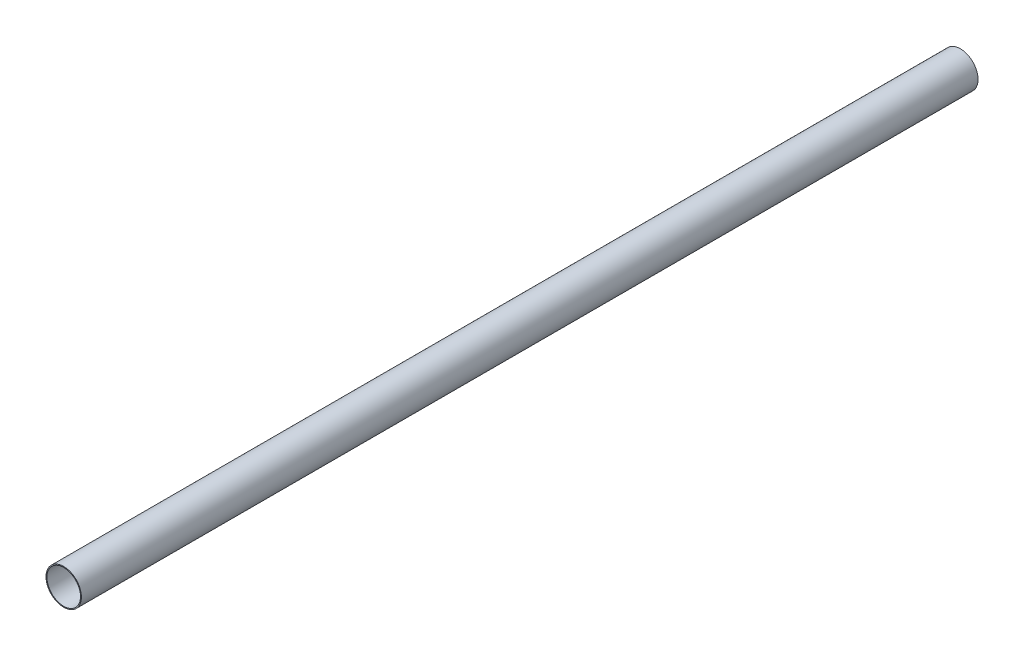
from build123d import *

# Parameters (mm, degrees)
SKIZZE1_R                       = 37.5
AUFSATZ_LINEAR_AUSTRAGEN2_DEPTH = 1900
WANDUNG2_T                      = -1.9


with BuildPart() as part:
    # Skizze1 → Aufsatz-Linear austragen2 (new body)
    with BuildSketch(Plane.XY):
        Circle(SKIZZE1_R)
    extrude(amount=AUFSATZ_LINEAR_AUSTRAGEN2_DEPTH)

    # Wandung2
    wandung2_openings = [part.faces().sort_by_distance(p)[0] for p in [
        (0, 0, 0),
        (0, 0, 1900),
    ]]
    offset(amount=WANDUNG2_T, openings=wandung2_openings, kind=Kind.INTERSECTION)


solid = part.part
